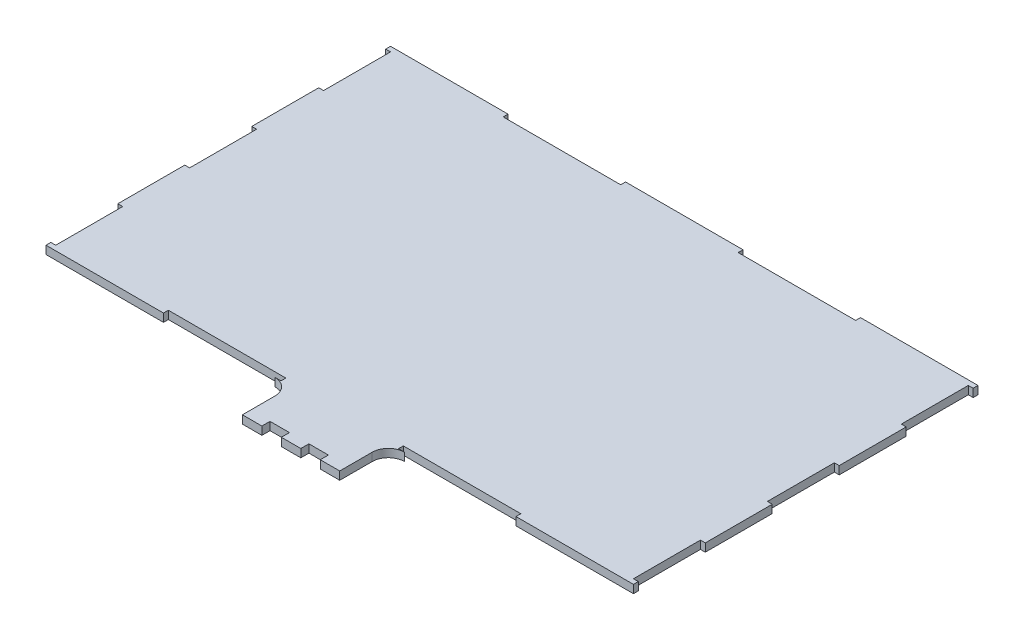
from build123d import *

# Parameters (mm, degrees)
BOSS_EXTRUDE1_DEPTH = 5


with BuildPart() as part:
    # Sketch1 → Boss-Extrude1 (new body)
    with BuildSketch(Plane(origin=(0, 0, 0), x_dir=(1, 0, 0), z_dir=(0, 1, 0))):
        with BuildLine():
            Line((-30.000015974, -136.250310986), (-18.000015974, -136.250310986))
            Line((-18.000015974, -136.250310986), (-18.000015974, -131.250310986))
            Line((-18.000015974, -131.250310986), (-6.000015974, -131.250310986))
            Line((-6.000015974, -131.250310986), (-6.000015974, -136.250310986))
            Line((-6.000015974, -136.250310986), (5.999984026, -136.250310986))
            Line((5.999984026, -136.250310986), (5.999984026, -131.250310986))
            Line((5.999984026, -131.250310986), (17.999984026, -131.250310986))
            Line((17.999984026, -131.250310986), (17.999984026, -136.250310986))
            Line((17.999984026, -136.250310986), (30.000006721, -136.250310986))
            Line((30.000006721, -136.250310986), (30.000006721, -116.24999063))
            ThreePointArc((30.000006721, -116.24999063), (32.92893891, -109.178922818), (40.000006721, -106.24999063))
            Line((40.000006721, -106.24999063), (36.229984025, -106.24999063))
            Line((36.229984025, -106.24999063), (36.229984025, -103.249670275))
            Line((36.229984025, -103.249670275), (108.689984025, -103.249670275))
            Line((108.689984025, -103.249670275), (108.689984025, -106.24999063))
            Line((108.689984025, -106.24999063), (181.149984025, -106.24999063))
            Line((181.149984025, -106.24999063), (181.149984025, -103.24999063))
            Line((181.149984025, -103.24999063), (178.149984476, -103.24999063))
            Line((178.149984476, -103.24999063), (178.149984476, -61.94999063))
            Line((178.149984476, -61.94999063), (181.149984025, -61.94999063))
            Line((181.149984025, -61.94999063), (181.149984025, -20.64999063))
            Line((181.149984025, -20.64999063), (178.149984927, -20.64999063))
            Line((178.149984927, -20.64999063), (178.149984927, 20.65000937))
            Line((178.149984927, 20.65000937), (181.149984025, 20.65000937))
            Line((181.149984025, 20.65000937), (181.149984025, 61.95000937))
            Line((181.149984025, 61.95000937), (178.149984927, 61.95000937))
            Line((178.149984927, 61.95000937), (178.149984927, 103.25000937))
            Line((178.149984927, 103.25000937), (181.149984025, 103.25000937))
            Line((181.149984025, 103.25000937), (181.150047924, 106.25000937))
            Line((181.150047924, 106.25000937), (108.689984025, 106.25000937))
            Line((108.689984025, 106.25000937), (108.689984025, 103.249689014))
            Line((108.689984025, 103.249689014), (36.229984025, 103.249689014))
            Line((36.229984025, 103.249689014), (36.229984025, 106.25000937))
            Line((36.229984025, 106.25000937), (-36.230015974, 106.25000937))
            Line((-36.230015974, 106.25000937), (-36.230015974, 103.249689014))
            Line((-36.230015974, 103.249689014), (-108.690015974, 103.249689014))
            Line((-108.690015974, 103.249689014), (-108.690015974, 106.25000937))
            Line((-108.690015974, 106.25000937), (-181.150015974, 106.25000937))
            Line((-181.150015974, 106.25000937), (-181.150015974, 103.25000937))
            Line((-181.150015974, 103.25000937), (-178.150016876, 103.25000937))
            Line((-178.150016876, 103.25000937), (-178.150016876, 61.95000937))
            Line((-178.150016876, 61.95000937), (-181.150015974, 61.95000937))
            Line((-181.150015974, 61.95000937), (-181.150015974, 20.65000937))
            Line((-181.150015974, 20.65000937), (-178.150016876, 20.65000937))
            Line((-178.150016876, 20.65000937), (-178.150016876, -20.64999063))
            Line((-178.150016876, -20.64999063), (-181.150015974, -20.64999063))
            Line((-181.150015974, -20.64999063), (-181.150015974, -61.94999063))
            Line((-181.150015974, -61.94999063), (-178.150016425, -61.94999063))
            Line((-178.150016425, -61.94999063), (-178.150016425, -103.24999063))
            Line((-178.150016425, -103.24999063), (-181.150015974, -103.24999063))
            Line((-181.150015974, -103.24999063), (-181.150015974, -106.24999063))
            Line((-181.150015974, -106.24999063), (-108.690015974, -106.24999063))
            Line((-108.690015974, -106.24999063), (-108.690015974, -103.249670275))
            Line((-108.690015974, -103.249670275), (-36.230015974, -103.249670275))
            Line((-36.230015974, -103.249670275), (-36.230015974, -106.24999063))
            Line((-36.230015974, -106.24999063), (-40.000015974, -106.24999063))
            ThreePointArc((-40.000015974, -106.24999063), (-32.928948162, -109.178922818), (-30.000015974, -116.24999063))
            Line((-30.000015974, -116.24999063), (-30.000015974, -136.250310986))
        make_face()
    extrude(amount=BOSS_EXTRUDE1_DEPTH)


solid = part.part
